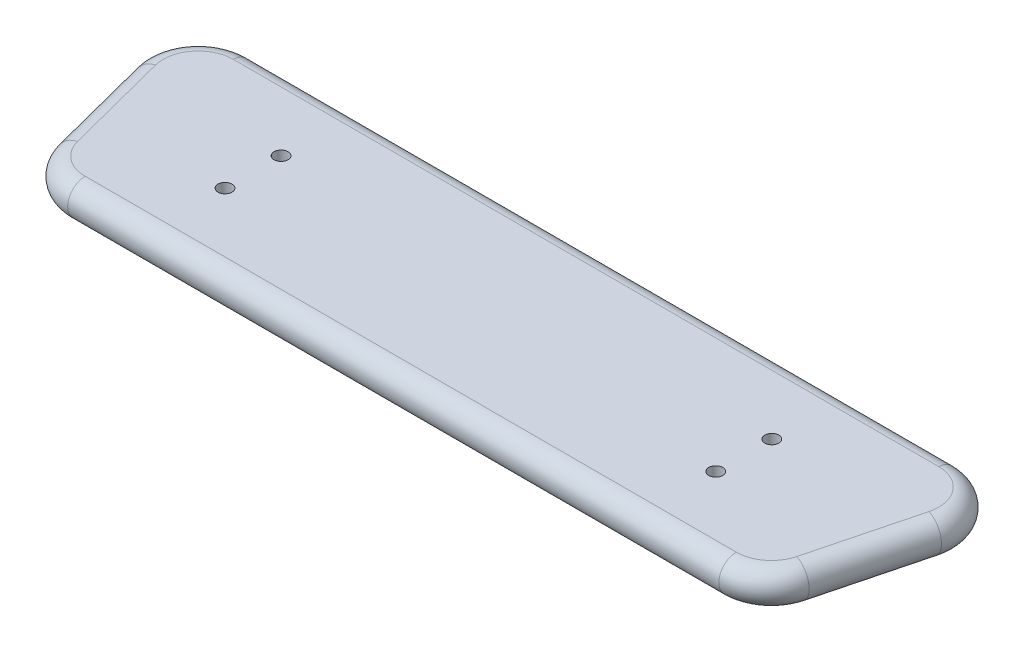
from build123d import *

# Parameters (mm, degrees)
BOSS_EXTRUDE1_DEPTH = 10
FILLET1_R           = 5
CUT_EXTRUDE3_START  = -2
SKETCH3_R           = 2
CUT_EXTRUDE3_DEPTH  = 8


with BuildPart() as part:
    # Sketch1 → Boss-Extrude1 (new body)
    with BuildSketch(Plane(origin=(0, 0, 0), x_dir=(1, 0, 0), z_dir=(0, 1, 0))):
        with BuildLine():
            Line((115.149446157, 11.244299939), (107.390918627, -18.755700061))
            ThreePointArc((107.390918627, -18.755700061), (102.051963222, -26.860343606), (92.868704021, -30))
            Line((92.868704021, -30), (-92.868704021, -30))
            ThreePointArc((-92.868704021, -30), (-102.051963222, -26.860343606), (-107.390918627, -18.755700061))
            Line((-107.390918627, -18.755700061), (-115.149446157, 11.244299939))
            ThreePointArc((-115.149446157, 11.244299939), (-112.487575158, 24.183259201), (-100.627231552, 30))
            Line((-100.627231552, 30), (100.627231552, 30))
            ThreePointArc((100.627231552, 30), (112.487575158, 24.183259201), (115.149446157, 11.244299939))
        make_face()
    extrude(amount=BOSS_EXTRUDE1_DEPTH)

    # Fillet1
    fillet1_edges = [part.edges().sort_by_distance(p)[0] for p in [
        (0, 0, 30),
        (-102.051963222, 0, 26.860343606),
        (-111.270182392, 0, 3.755700061),
        (-112.487575158, 0, -24.183259201),
        (0, 10, 30),
        (102.051963222, 10, 26.860343606),
        (111.270182392, 10, 3.755700061),
        (112.487575158, 10, -24.183259201),
        (0, 10, -30),
        (0, 0, -30),
        (-111.270182392, 10, 3.755700061),
        (111.270182392, 0, 3.755700061),
    ]]
    fillet(fillet1_edges, radius=FILLET1_R - 0.0001)  # a hair under: the kernel refuses the full size

    # Sketch3 → Cut-Extrude3 (cut)
    with BuildSketch(Plane.XZ.offset(CUT_EXTRUDE3_START)):
        with Locations(Location((-70, 8, 0), (0, 0, 270))):
            Circle(SKETCH3_R)
        with Locations(Location((-70, -8, 0), (0, 0, 90))):
            Circle(SKETCH3_R)
        with Locations(Location((70, -8, 0), (0, 0, 270))):
            Circle(SKETCH3_R)
        with Locations(Location((70, 8, 0), (0, 0, 90))):
            Circle(SKETCH3_R)
    extrude(amount=-CUT_EXTRUDE3_DEPTH, mode=Mode.SUBTRACT)


solid = part.part
